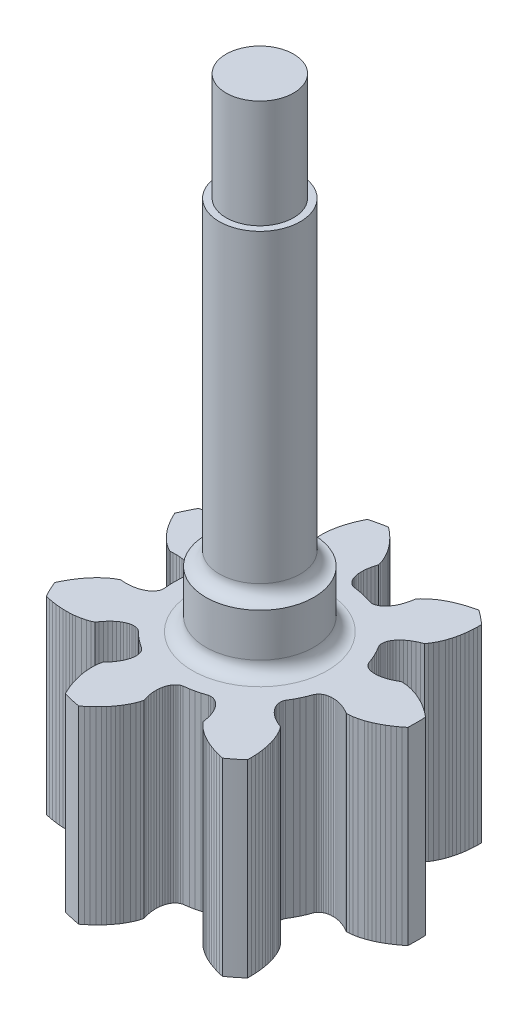
from build123d import *

# Parameters (mm, degrees)
SKETCH1_R           = 2
BOSS_EXTRUDE1_DEPTH = 2.1
SKETCH2_R           = 1.5
BOSS_EXTRUDE3_DEPTH = 15.8
BOSS_EXTRUDE4_DEPTH = 7
SKETCH3_R           = 1.1
SKETCH3_R_2         = 0.75
CUT_EXTRUDE2_DEPTH  = 20.676208923
FILLET1_R           = 0.5
CHAMFER1_SIZE       = 0.4
CUT_EXTRUDE3_START  = -4
SKETCH5_R           = 1.5
SKETCH5_R_2         = 1.25
CUT_EXTRUDE3_DEPTH  = 4


with BuildPart() as part:
    # Sketch1 → Boss-Extrude1 (new body)
    with BuildSketch(Plane(origin=(0, 0, 0), x_dir=(1, 0, 0), z_dir=(0, 1, 0))):
        with Locations(Location((0, 0, 0), (0, 0, 270))):
            Circle(SKETCH1_R)
    extrude(amount=BOSS_EXTRUDE1_DEPTH)

    # Sketch2 → Boss-Extrude3 (add)
    with BuildSketch(Plane(origin=(0, 2.1, 0), x_dir=(1, 0, 0), z_dir=(0, 1, 0))):
        with Locations(Location((0, 0, 0), (0, 0, 270))):
            Circle(SKETCH2_R)
    extrude(amount=BOSS_EXTRUDE3_DEPTH)

    # Sketch4 → Boss-Extrude4 (add)
    with BuildSketch(Plane.XZ):
        with BuildLine():
            Line((-1.677656104, -5.457545802), (-1.740166904, -5.314388502))
            Line((-1.740166904, -5.314388502), (-1.793915704, -5.175673402))
            Line((-1.793915704, -5.175673402), (-1.839244704, -5.042342702))
            Line((-1.839244704, -5.042342702), (-1.876421604, -4.915999102))
            Line((-1.876421604, -4.915999102), (-1.907053904, -4.793237402))
            Line((-1.907053904, -4.793237402), (-1.931099704, -4.676009702))
            Line((-1.931099704, -4.676009702), (-1.948773704, -4.566830802))
            Line((-1.948773704, -4.566830802), (-1.961024804, -4.464035702))
            Line((-1.961024804, -4.464035702), (-1.971502404, -4.279785302))
            Line((-1.971502404, -4.279785302), (-1.967365804, -4.124635702))
            Line((-1.967365804, -4.124635702), (-1.953730504, -4.000928102))
            Line((-1.953730504, -4.000928102), (-1.930260404, -3.886700602))
            Line((-1.930260404, -3.886700602), (-1.859391804, -3.809735002))
            Line((-1.859391804, -3.809735002), (-1.778417204, -3.712510502))
            Line((-1.778417204, -3.712510502), (-1.708697804, -3.615493902))
            Line((-1.708697804, -3.615493902), (-1.650076104, -3.519450202))
            Line((-1.650076104, -3.519450202), (-1.602332404, -3.425130202))
            Line((-1.602332404, -3.425130202), (-1.565200104, -3.333258302))
            Line((-1.565200104, -3.333258302), (-1.538382904, -3.244569502))
            Line((-1.538382904, -3.244569502), (-1.521548504, -3.159737902))
            Line((-1.521548504, -3.159737902), (-1.514299404, -3.079451802))
            Line((-1.514299404, -3.079451802), (-1.516222204, -3.004347502))
            Line((-1.516222204, -3.004347502), (-1.526863004, -2.935043002))
            Line((-1.526863004, -2.935043002), (-1.545721204, -2.872129302))
            Line((-1.545721204, -2.872129302), (-1.572279104, -2.816160102))
            Line((-1.572279104, -2.816160102), (-1.605971904, -2.767662302))
            Line((-1.605971904, -2.767662302), (-1.657232504, -2.718290402))
            Line((-1.657232504, -2.718290402), (-1.844744204, -2.592775302))
            Line((-1.844744204, -2.592775302), (-1.984007204, -2.487817902))
            Line((-1.984007204, -2.487817902), (-2.117322004, -2.375401802))
            Line((-2.117322004, -2.375401802), (-2.281415504, -2.220521102))
            Line((-2.281415504, -2.220521102), (-2.340956004, -2.181532002))
            Line((-2.340956004, -2.181532002), (-2.395735304, -2.159475702))
            Line((-2.395735304, -2.159475702), (-2.456210904, -2.146038102))
            Line((-2.456210904, -2.146038102), (-2.521743604, -2.141652302))
            Line((-2.521743604, -2.141652302), (-2.591678304, -2.146699902))
            Line((-2.591678304, -2.146699902), (-2.665327304, -2.161537602))
            Line((-2.665327304, -2.161537602), (-2.741987504, -2.186470302))
            Line((-2.741987504, -2.186470302), (-2.820946104, -2.221759402))
            Line((-2.820946104, -2.221759402), (-2.901443904, -2.267639402))
            Line((-2.901443904, -2.267639402), (-2.982749704, -2.324284202))
            Line((-2.982749704, -2.324284202), (-3.064080904, -2.391819002))
            Line((-3.064080904, -2.391819002), (-3.144672004, -2.470342602))
            Line((-3.144672004, -2.470342602), (-3.223742204, -2.559902302))
            Line((-3.223742204, -2.559902302), (-3.300510504, -2.660481102))
            Line((-3.300510504, -2.660481102), (-3.359776704, -2.746699402))
            Line((-3.359776704, -2.746699402), (-3.465917704, -2.794999002))
            Line((-3.465917704, -2.794999002), (-3.583489604, -2.835820002))
            Line((-3.583489604, -2.835820002), (-3.733828804, -2.874377002))
            Line((-3.733828804, -2.874377002), (-3.915791104, -2.905161502))
            Line((-3.915791104, -2.905161502), (-4.018735004, -2.916091602))
            Line((-4.018735004, -2.916091602), (-4.129109504, -2.923155402))
            Line((-4.129109504, -2.923155402), (-4.248748704, -2.925798102))
            Line((-4.248748704, -2.925798102), (-4.375248804, -2.923250802))
            Line((-4.375248804, -2.923250802), (-4.506697404, -2.915120202))
            Line((-4.506697404, -2.915120202), (-4.646771904, -2.900596502))
            Line((-4.646771904, -2.900596502), (-4.793969404, -2.879062302))
            Line((-4.793969404, -2.879062302), (-4.947447304, -2.849974302))
            Line((-4.947447304, -2.849974302), (-5.090225304, -2.816749202))
            ThreePointArc((-5.090225304, -2.816749202), (-5.241476502, -2.524161997), (-5.375926806, -2.223483907))
            Line((-5.375926806, -2.223483907), (-5.312882596, -2.091140098))
            Line((-5.312882596, -2.091140098), (-5.239932596, -1.953010098))
            Line((-5.239932596, -1.953010098), (-5.164992596, -1.824500098))
            Line((-5.164992596, -1.824500098), (-5.089012596, -1.705930098))
            Line((-5.089012596, -1.705930098), (-5.013412596, -1.598090098))
            Line((-5.013412596, -1.598090098), (-4.936532596, -1.497600098))
            Line((-4.936532596, -1.497600098), (-4.859872596, -1.405710098))
            Line((-4.859872596, -1.405710098), (-4.785532596, -1.323820098))
            Line((-4.785532596, -1.323820098), (-4.712802596, -1.250150098))
            Line((-4.712802596, -1.250150098), (-4.575282596, -1.127080098))
            Line((-4.575282596, -1.127080098), (-4.451402596, -1.033580098))
            Line((-4.451402596, -1.033580098), (-4.346182596, -0.967110098))
            Line((-4.346182596, -0.967110098), (-4.242242596, -0.914240098))
            Line((-4.242242596, -0.914240098), (-4.137882596, -0.921660098))
            Line((-4.137882596, -0.921660098), (-4.011382596, -0.924350098))
            Line((-4.011382596, -0.924350098), (-3.892062596, -0.918370098))
            Line((-3.892062596, -0.918370098), (-3.780422596, -0.904320098))
            Line((-3.780422596, -0.904320098), (-3.676912596, -0.882840098))
            Line((-3.676912596, -0.882840098), (-3.581932596, -0.854590098))
            Line((-3.581932596, -0.854590098), (-3.495872596, -0.820260098))
            Line((-3.495872596, -0.820260098), (-3.419052596, -0.780530098))
            Line((-3.419052596, -0.780530098), (-3.351762596, -0.736140098))
            Line((-3.351762596, -0.736140098), (-3.294242596, -0.687810098))
            Line((-3.294242596, -0.687810098), (-3.246692596, -0.636280098))
            Line((-3.246692596, -0.636280098), (-3.209262596, -0.582310098))
            Line((-3.209262596, -0.582310098), (-3.182062596, -0.526650098))
            Line((-3.182062596, -0.526650098), (-3.165152596, -0.470070098))
            Line((-3.165152596, -0.470070098), (-3.158512596, -0.399210098))
            Line((-3.158512596, -0.399210098), (-3.177292596, -0.174350098))
            Line((-3.177292596, -0.174350098), (-3.182062596, -3.0098e-05))
            Line((-3.182062596, -3.0098e-05), (-3.177292596, 0.174289902))
            Line((-3.177292596, 0.174289902), (-3.158512596, 0.399149902))
            Line((-3.158512596, 0.399149902), (-3.165152596, 0.470009902))
            Line((-3.165152596, 0.470009902), (-3.182062596, 0.526589902))
            Line((-3.182062596, 0.526589902), (-3.209262596, 0.582249902))
            Line((-3.209262596, 0.582249902), (-3.246692596, 0.636219902))
            Line((-3.246692596, 0.636219902), (-3.294242596, 0.687749902))
            Line((-3.294242596, 0.687749902), (-3.351762596, 0.736079902))
            Line((-3.351762596, 0.736079902), (-3.419052596, 0.780469902))
            Line((-3.419052596, 0.780469902), (-3.495872596, 0.820199902))
            Line((-3.495872596, 0.820199902), (-3.581932596, 0.854529902))
            Line((-3.581932596, 0.854529902), (-3.676912596, 0.882779902))
            Line((-3.676912596, 0.882779902), (-3.780422596, 0.904259902))
            Line((-3.780422596, 0.904259902), (-3.892062596, 0.918309902))
            Line((-3.892062596, 0.918309902), (-4.011382596, 0.924289902))
            Line((-4.011382596, 0.924289902), (-4.137882596, 0.921599902))
            Line((-4.137882596, 0.921599902), (-4.242242596, 0.914179902))
            Line((-4.242242596, 0.914179902), (-4.346182596, 0.967049902))
            Line((-4.346182596, 0.967049902), (-4.451402596, 1.033519902))
            Line((-4.451402596, 1.033519902), (-4.575282596, 1.127019902))
            Line((-4.575282596, 1.127019902), (-4.712802596, 1.250089902))
            Line((-4.712802596, 1.250089902), (-4.785532596, 1.323759902))
            Line((-4.785532596, 1.323759902), (-4.859872596, 1.405649902))
            Line((-4.859872596, 1.405649902), (-4.936532596, 1.497539902))
            Line((-4.936532596, 1.497539902), (-5.013412596, 1.598029902))
            Line((-5.013412596, 1.598029902), (-5.089012596, 1.705869902))
            Line((-5.089012596, 1.705869902), (-5.164992596, 1.824439902))
            Line((-5.164992596, 1.824439902), (-5.239932596, 1.952949902))
            Line((-5.239932596, 1.952949902), (-5.312882596, 2.091079902))
            Line((-5.312882596, 2.091079902), (-5.375926796, 2.223423702))
            ThreePointArc((-5.375926796, 2.223423702), (-5.241476491, 2.524101771), (-5.090225294, 2.816688957))
            Line((-5.090225294, 2.816688957), (-4.947447286, 2.849914054))
            Line((-4.947447286, 2.849914054), (-4.793969386, 2.879002054))
            Line((-4.793969386, 2.879002054), (-4.646771886, 2.900536254))
            Line((-4.646771886, 2.900536254), (-4.506697386, 2.915059954))
            Line((-4.506697386, 2.915059954), (-4.375248786, 2.923190554))
            Line((-4.375248786, 2.923190554), (-4.248748686, 2.925737854))
            Line((-4.248748686, 2.925737854), (-4.129109486, 2.923095154))
            Line((-4.129109486, 2.923095154), (-4.018734986, 2.916031354))
            Line((-4.018734986, 2.916031354), (-3.915791086, 2.905101254))
            Line((-3.915791086, 2.905101254), (-3.733828786, 2.874316754))
            Line((-3.733828786, 2.874316754), (-3.583489586, 2.835759754))
            Line((-3.583489586, 2.835759754), (-3.465917686, 2.794938754))
            Line((-3.465917686, 2.794938754), (-3.359776686, 2.746639154))
            Line((-3.359776686, 2.746639154), (-3.300510486, 2.660420854))
            Line((-3.300510486, 2.660420854), (-3.223742186, 2.559842054))
            Line((-3.223742186, 2.559842054), (-3.144671986, 2.470282354))
            Line((-3.144671986, 2.470282354), (-3.064080886, 2.391758754))
            Line((-3.064080886, 2.391758754), (-2.982749686, 2.324223954))
            Line((-2.982749686, 2.324223954), (-2.901443886, 2.267579154))
            Line((-2.901443886, 2.267579154), (-2.820946086, 2.221699154))
            Line((-2.820946086, 2.221699154), (-2.741987486, 2.186410054))
            Line((-2.741987486, 2.186410054), (-2.665327286, 2.161477354))
            Line((-2.665327286, 2.161477354), (-2.591678286, 2.146639654))
            Line((-2.591678286, 2.146639654), (-2.521743586, 2.141592054))
            Line((-2.521743586, 2.141592054), (-2.456210886, 2.145977854))
            Line((-2.456210886, 2.145977854), (-2.395735286, 2.159415454))
            Line((-2.395735286, 2.159415454), (-2.340955986, 2.181471754))
            Line((-2.340955986, 2.181471754), (-2.281415486, 2.220460854))
            Line((-2.281415486, 2.220460854), (-2.117321986, 2.375341554))
            Line((-2.117321986, 2.375341554), (-1.984007186, 2.487757654))
            Line((-1.984007186, 2.487757654), (-1.844744186, 2.592715054))
            Line((-1.844744186, 2.592715054), (-1.657232486, 2.718230154))
            Line((-1.657232486, 2.718230154), (-1.605971886, 2.767602054))
            Line((-1.605971886, 2.767602054), (-1.572279086, 2.816099854))
            Line((-1.572279086, 2.816099854), (-1.545721186, 2.872069054))
            Line((-1.545721186, 2.872069054), (-1.526862986, 2.934982754))
            Line((-1.526862986, 2.934982754), (-1.516222186, 3.004287254))
            Line((-1.516222186, 3.004287254), (-1.514299386, 3.079391554))
            Line((-1.514299386, 3.079391554), (-1.521548486, 3.159677654))
            Line((-1.521548486, 3.159677654), (-1.538382886, 3.244509254))
            Line((-1.538382886, 3.244509254), (-1.565200086, 3.333198054))
            Line((-1.565200086, 3.333198054), (-1.602332386, 3.425069954))
            Line((-1.602332386, 3.425069954), (-1.650076086, 3.519389954))
            Line((-1.650076086, 3.519389954), (-1.708697786, 3.615433654))
            Line((-1.708697786, 3.615433654), (-1.778417186, 3.712450254))
            Line((-1.778417186, 3.712450254), (-1.859391786, 3.809674754))
            Line((-1.859391786, 3.809674754), (-1.930260386, 3.886640354))
            Line((-1.930260386, 3.886640354), (-1.953730486, 4.000867854))
            Line((-1.953730486, 4.000867854), (-1.967365786, 4.124575454))
            Line((-1.967365786, 4.124575454), (-1.971502386, 4.279725054))
            Line((-1.971502386, 4.279725054), (-1.961024786, 4.463975454))
            Line((-1.961024786, 4.463975454), (-1.948773686, 4.566770554))
            Line((-1.948773686, 4.566770554), (-1.931099686, 4.675949454))
            Line((-1.931099686, 4.675949454), (-1.907053886, 4.793177154))
            Line((-1.907053886, 4.793177154), (-1.876421586, 4.915938854))
            Line((-1.876421586, 4.915938854), (-1.839244686, 5.042282454))
            Line((-1.839244686, 5.042282454), (-1.793915686, 5.175613154))
            Line((-1.793915686, 5.175613154), (-1.740166886, 5.314328254))
            Line((-1.740166886, 5.314328254), (-1.677656086, 5.457485554))
            Line((-1.677656086, 5.457485554), (-1.613492886, 5.589290554))
            ThreePointArc((-1.613492886, 5.589290554), (-1.294584924, 5.671642777), (-0.971527485, 5.735814951))
            Line((-0.971527485, 5.735814951), (-0.856530379, 5.644902123))
            Line((-0.856530379, 5.644902123), (-0.738096579, 5.543044323))
            Line((-0.738096579, 5.543044323), (-0.629484279, 5.441387023))
            Line((-0.629484279, 5.441387023), (-0.530794179, 5.340927723))
            Line((-0.530794179, 5.340927723), (-0.442480579, 5.243226523))
            Line((-0.442480579, 5.243226523), (-0.361617479, 5.145912923))
            Line((-0.361617479, 5.145912923), (-0.289089779, 5.050727423))
            Line((-0.289089779, 5.050727423), (-0.225795179, 4.960029123))
            Line((-0.225795179, 4.960029123), (-0.170156179, 4.872729423))
            Line((-0.170156179, 4.872729423), (-0.080772879, 4.711271723))
            Line((-0.080772879, 4.711271723), (-0.017182979, 4.569691923))
            Line((-0.017182979, 4.569691923), (0.024206821, 4.452319023))
            Line((0.024206821, 4.452319023), (0.052622421, 4.339220423))
            Line((0.052622421, 4.339220423), (0.022166221, 4.239128023))
            Line((0.022166221, 4.239128023), (-0.008605279, 4.116398223))
            Line((-0.008605279, 4.116398223), (-0.029326379, 3.998739123))
            Line((-0.029326379, 3.998739123), (-0.040470879, 3.886771723))
            Line((-0.040470879, 3.886771723), (-0.042562579, 3.781077223))
            Line((-0.042562579, 3.781077223), (-0.036155879, 3.682192323))
            Line((-0.036155879, 3.682192323), (-0.021836779, 3.590650923))
            Line((-0.021836779, 3.590650923), (-0.000196979, 3.506916223))
            Line((-0.000196979, 3.506916223), (0.028106621, 3.431435623))
            Line((0.028106621, 3.431435623), (0.062425521, 3.364603323))
            Line((0.062425521, 3.364603323), (0.102082621, 3.306779023))
            Line((0.102082621, 3.306779023), (0.146370621, 3.258277923))
            Line((0.146370621, 3.258277923), (0.194582521, 3.219374423))
            Line((0.194582521, 3.219374423), (0.245981121, 3.190298123))
            Line((0.245981121, 3.190298123), (0.313586921, 3.168056823))
            Line((0.313586921, 3.168056823), (0.536988121, 3.136329923))
            Line((0.536988121, 3.136329923), (0.707999021, 3.102190423))
            Line((0.707999021, 3.102190423), (0.876887021, 3.058750223))
            Line((0.876887021, 3.058750223), (1.091930421, 2.990405023))
            Line((1.091930421, 2.990405023), (1.162491321, 2.981110623))
            Line((1.162491321, 2.981110623), (1.221415521, 2.985006423))
            Line((1.221415521, 2.985006423), (1.281732621, 2.999139023))
            Line((1.281732621, 2.999139023), (1.342678421, 3.023621123))
            Line((1.342678421, 3.023621123), (1.403497321, 3.058512423))
            Line((1.403497321, 3.058512423), (1.463415021, 3.103835823))
            Line((1.463415021, 3.103835823), (1.521665521, 3.159561023))
            Line((1.521665521, 3.159561023), (1.577493421, 3.225614223))
            Line((1.577493421, 3.225614223), (1.630112821, 3.301877423))
            Line((1.630112821, 3.301877423), (1.678789621, 3.388189823))
            Line((1.678789621, 3.388189823), (1.722764221, 3.484324823))
            Line((1.722764221, 3.484324823), (1.761304221, 3.590039423))
            Line((1.761304221, 3.590039423), (1.793685421, 3.705037123))
            Line((1.793685421, 3.705037123), (1.819211821, 3.828964023))
            Line((1.819211821, 3.828964023), (1.835200121, 3.932358623))
            Line((1.835200121, 3.932358623), (1.909873421, 4.021928023))
            Line((1.909873421, 4.021928023), (1.998090521, 4.109718923))
            Line((1.998090521, 4.109718923), (2.116812121, 4.209687323))
            Line((2.116812121, 4.209687323), (2.267397621, 4.316373723))
            Line((2.267397621, 4.316373723), (2.355404521, 4.370887123))
            Line((2.355404521, 4.370887123), (2.451783521, 4.425141023))
            Line((2.451783521, 4.425141023), (2.558428121, 4.479431523))
            Line((2.558428121, 4.479431523), (2.673506021, 4.532022823))
            Line((2.673506021, 4.532022823), (2.795464821, 4.581730723))
            Line((2.795464821, 4.581730723), (2.927969221, 4.629421523))
            Line((2.927969221, 4.629421523), (3.069932921, 4.673886423))
            Line((3.069932921, 4.673886423), (3.220832621, 4.714270623))
            Line((3.220832621, 4.714270623), (3.363886921, 4.746284823))
            ThreePointArc((3.363886921, 4.746284823), (3.627108363, 4.548298309), (3.878703226, 4.335732528))
            Line((3.878703226, 4.335732528), (3.879324236, 4.189141042))
            Line((3.879324236, 4.189141042), (3.873530936, 4.033038442))
            Line((3.873530936, 4.033038442), (3.861770736, 3.884739642))
            Line((3.861770736, 3.884739642), (3.844760636, 3.744945242))
            Line((3.844760636, 3.744945242), (3.823437436, 3.614983242))
            Line((3.823437436, 3.614983242), (3.797771936, 3.491087842))
            Line((3.797771936, 3.491087842), (3.768573236, 3.375036342))
            Line((3.768573236, 3.375036342), (3.737125936, 3.269001042))
            Line((3.737125936, 3.269001042), (3.703562736, 3.171070342))
            Line((3.703562736, 3.171070342), (3.633059536, 3.000520342))
            Line((3.633059536, 3.000520342), (3.562015636, 2.862530242))
            Line((3.562015636, 2.862530242), (3.496055936, 2.756989642))
            Line((3.496055936, 2.756989642), (3.425348736, 2.664257542))
            Line((3.425348736, 2.664257542), (3.328104136, 2.625662642))
            Line((3.328104136, 2.625662642), (3.212964436, 2.573199942))
            Line((3.212964436, 2.573199942), (3.108055436, 2.516041142))
            Line((3.108055436, 2.516041142), (3.013567336, 2.454943742))
            Line((3.013567336, 2.454943742), (2.929627936, 2.390679642))
            Line((2.929627936, 2.390679642), (2.856311136, 2.324016942))
            Line((2.856311136, 2.324016942), (2.793668936, 2.255746642))
            Line((2.793668936, 2.255746642), (2.741694736, 2.186620242))
            Line((2.741694736, 2.186620242), (2.700328636, 2.117430142))
            Line((2.700328636, 2.117430142), (2.669474536, 2.048929342))
            Line((2.669474536, 2.048929342), (2.648991436, 1.981871242))
            Line((2.648991436, 1.981871242), (2.638684936, 1.917005642))
            Line((2.638684936, 1.917005642), (2.638328536, 1.855056142))
            Line((2.638328536, 1.855056142), (2.647642236, 1.796742342))
            Line((2.647642236, 1.796742342), (2.672404836, 1.730018642))
            Line((2.672404836, 1.730018642), (2.786888136, 1.535575142))
            Line((2.786888136, 1.535575142), (2.866820336, 1.380587942))
            Line((2.866820336, 1.380587942), (2.938157336, 1.221461342))
            Line((2.938157336, 1.221461342), (3.018800236, 1.010721142))
            Line((3.018800236, 1.010721142), (3.055527736, 0.949759542))
            Line((3.055527736, 0.949759542), (3.095312236, 0.906119642))
            Line((3.095312236, 0.906119642), (3.143968536, 0.867773342))
            Line((3.143968536, 0.867773342), (3.201108536, 0.835388342))
            Line((3.201108536, 0.835388342), (3.266307636, 0.809592642))
            Line((3.266307636, 0.809592642), (3.339100936, 0.791005742))
            Line((3.339100936, 0.791005742), (3.418987236, 0.780207842))
            Line((3.418987236, 0.780207842), (3.505437836, 0.777743242))
            Line((3.505437836, 0.777743242), (3.597870436, 0.784153042))
            Line((3.597870436, 0.784153042), (3.695701736, 0.799910942))
            Line((3.695701736, 0.799910942), (3.798280836, 0.825469442))
            Line((3.798280836, 0.825469442), (3.904961036, 0.861249642))
            Line((3.904961036, 0.861249642), (4.015059336, 0.907632842))
            Line((4.015059336, 0.907632842), (4.127864736, 0.964942742))
            Line((4.127864736, 0.964942742), (4.218670436, 1.016908042))
            Line((4.218670436, 1.016908042), (4.335256536, 1.014371642))
            Line((4.335256536, 1.014371642), (4.458896736, 1.000137542))
            Line((4.458896736, 1.000137542), (4.611076836, 0.969646442))
            Line((4.611076836, 0.969646442), (4.788376236, 0.918431942))
            Line((4.788376236, 0.918431942), (4.885867836, 0.883613842))
            Line((4.885867836, 0.883613842), (4.988376636, 0.842088442))
            Line((4.988376636, 0.842088442), (5.097314536, 0.792559942))
            Line((5.097314536, 0.792559942), (5.210181936, 0.735378542))
            Line((5.210181936, 0.735378542), (5.325085236, 0.671019742))
            Line((5.325085236, 0.671019742), (5.444986436, 0.597158342))
            Line((5.444986436, 0.597158342), (5.568263436, 0.513890042))
            Line((5.568263436, 0.513890042), (5.693921436, 0.421091042))
            Line((5.693921436, 0.421091042), (5.808144136, 0.329207242))
            ThreePointArc((5.808144136, 0.329207242), (5.817467929, -3.016e-05), (5.808144136, -0.329267562))
            Line((5.808144136, -0.329267562), (5.693921429, -0.421151358))
            Line((5.693921429, -0.421151358), (5.568263429, -0.513950358))
            Line((5.568263429, -0.513950358), (5.444986429, -0.597218658))
            Line((5.444986429, -0.597218658), (5.325085229, -0.671080058))
            Line((5.325085229, -0.671080058), (5.210181929, -0.735438858))
            Line((5.210181929, -0.735438858), (5.097314529, -0.792620258))
            Line((5.097314529, -0.792620258), (4.988376629, -0.842148758))
            Line((4.988376629, -0.842148758), (4.885867829, -0.883674158))
            Line((4.885867829, -0.883674158), (4.788376229, -0.918492258))
            Line((4.788376229, -0.918492258), (4.611076829, -0.969706758))
            Line((4.611076829, -0.969706758), (4.458896729, -1.000197858))
            Line((4.458896729, -1.000197858), (4.335256529, -1.014431958))
            Line((4.335256529, -1.014431958), (4.218670429, -1.016968358))
            Line((4.218670429, -1.016968358), (4.127864729, -0.965003058))
            Line((4.127864729, -0.965003058), (4.015059329, -0.907693158))
            Line((4.015059329, -0.907693158), (3.904961029, -0.861309958))
            Line((3.904961029, -0.861309958), (3.798280829, -0.825529758))
            Line((3.798280829, -0.825529758), (3.695701729, -0.799971258))
            Line((3.695701729, -0.799971258), (3.597870429, -0.784213358))
            Line((3.597870429, -0.784213358), (3.505437829, -0.777803558))
            Line((3.505437829, -0.777803558), (3.418987229, -0.780268158))
            Line((3.418987229, -0.780268158), (3.339100929, -0.791066058))
            Line((3.339100929, -0.791066058), (3.266307629, -0.809652958))
            Line((3.266307629, -0.809652958), (3.201108529, -0.835448658))
            Line((3.201108529, -0.835448658), (3.143968529, -0.867833658))
            Line((3.143968529, -0.867833658), (3.095312229, -0.906179958))
            Line((3.095312229, -0.906179958), (3.055527729, -0.949819858))
            Line((3.055527729, -0.949819858), (3.018800229, -1.010781458))
            Line((3.018800229, -1.010781458), (2.938157329, -1.221521658))
            Line((2.938157329, -1.221521658), (2.866820329, -1.380648258))
            Line((2.866820329, -1.380648258), (2.786888129, -1.535635458))
            Line((2.786888129, -1.535635458), (2.672404829, -1.730078958))
            Line((2.672404829, -1.730078958), (2.647642229, -1.796802658))
            Line((2.647642229, -1.796802658), (2.638328529, -1.855116458))
            Line((2.638328529, -1.855116458), (2.638684929, -1.917065958))
            Line((2.638684929, -1.917065958), (2.648991429, -1.981931558))
            Line((2.648991429, -1.981931558), (2.669474529, -2.048989658))
            Line((2.669474529, -2.048989658), (2.700328629, -2.117490458))
            Line((2.700328629, -2.117490458), (2.741694729, -2.186680558))
            Line((2.741694729, -2.186680558), (2.793668929, -2.255806958))
            Line((2.793668929, -2.255806958), (2.856311129, -2.324077258))
            Line((2.856311129, -2.324077258), (2.929627929, -2.390739958))
            Line((2.929627929, -2.390739958), (3.013567329, -2.455004058))
            Line((3.013567329, -2.455004058), (3.108055429, -2.516101458))
            Line((3.108055429, -2.516101458), (3.212964429, -2.573260258))
            Line((3.212964429, -2.573260258), (3.328104129, -2.625722958))
            Line((3.328104129, -2.625722958), (3.425348729, -2.664317858))
            Line((3.425348729, -2.664317858), (3.496055929, -2.757049958))
            Line((3.496055929, -2.757049958), (3.562015629, -2.862590558))
            Line((3.562015629, -2.862590558), (3.633059529, -3.000580658))
            Line((3.633059529, -3.000580658), (3.703562729, -3.171130658))
            Line((3.703562729, -3.171130658), (3.737125929, -3.269061358))
            Line((3.737125929, -3.269061358), (3.768573229, -3.375096658))
            Line((3.768573229, -3.375096658), (3.797771929, -3.491148158))
            Line((3.797771929, -3.491148158), (3.823437429, -3.615043558))
            Line((3.823437429, -3.615043558), (3.844760629, -3.745005558))
            Line((3.844760629, -3.745005558), (3.861770729, -3.884799958))
            Line((3.861770729, -3.884799958), (3.873530929, -4.033098758))
            Line((3.873530929, -4.033098758), (3.879324229, -4.189201358))
            Line((3.879324229, -4.189201358), (3.878703229, -4.335792858))
            ThreePointArc((3.878703229, -4.335792858), (3.627108367, -4.548358644), (3.363886927, -4.746345161))
            Line((3.363886927, -4.746345161), (3.220832594, -4.714330914))
            Line((3.220832594, -4.714330914), (3.069932894, -4.673946714))
            Line((3.069932894, -4.673946714), (2.927969194, -4.629481814))
            Line((2.927969194, -4.629481814), (2.795464794, -4.581791014))
            Line((2.795464794, -4.581791014), (2.673505994, -4.532083114))
            Line((2.673505994, -4.532083114), (2.558428094, -4.479491814))
            Line((2.558428094, -4.479491814), (2.451783494, -4.425201314))
            Line((2.451783494, -4.425201314), (2.355404494, -4.370947414))
            Line((2.355404494, -4.370947414), (2.267397594, -4.316434014))
            Line((2.267397594, -4.316434014), (2.116812094, -4.209747614))
            Line((2.116812094, -4.209747614), (1.998090494, -4.109779214))
            Line((1.998090494, -4.109779214), (1.909873394, -4.021988314))
            Line((1.909873394, -4.021988314), (1.835200094, -3.932418914))
            Line((1.835200094, -3.932418914), (1.819211794, -3.829024314))
            Line((1.819211794, -3.829024314), (1.793685394, -3.705097414))
            Line((1.793685394, -3.705097414), (1.761304194, -3.590099714))
            Line((1.761304194, -3.590099714), (1.722764194, -3.484385114))
            Line((1.722764194, -3.484385114), (1.678789594, -3.388250114))
            Line((1.678789594, -3.388250114), (1.630112794, -3.301937714))
            Line((1.630112794, -3.301937714), (1.577493394, -3.225674514))
            Line((1.577493394, -3.225674514), (1.521665494, -3.159621314))
            Line((1.521665494, -3.159621314), (1.463414994, -3.103896114))
            Line((1.463414994, -3.103896114), (1.403497294, -3.058572714))
            Line((1.403497294, -3.058572714), (1.342678394, -3.023681414))
            Line((1.342678394, -3.023681414), (1.281732594, -2.999199314))
            Line((1.281732594, -2.999199314), (1.221415494, -2.985066714))
            Line((1.221415494, -2.985066714), (1.162491294, -2.981170914))
            Line((1.162491294, -2.981170914), (1.091930394, -2.990465314))
            Line((1.091930394, -2.990465314), (0.876886994, -3.058810514))
            Line((0.876886994, -3.058810514), (0.707998994, -3.102250714))
            Line((0.707998994, -3.102250714), (0.536988094, -3.136390214))
            Line((0.536988094, -3.136390214), (0.313586894, -3.168117114))
            Line((0.313586894, -3.168117114), (0.245981094, -3.190358414))
            Line((0.245981094, -3.190358414), (0.194582494, -3.219434714))
            Line((0.194582494, -3.219434714), (0.146370594, -3.258338214))
            Line((0.146370594, -3.258338214), (0.102082594, -3.306839314))
            Line((0.102082594, -3.306839314), (0.062425494, -3.364663614))
            Line((0.062425494, -3.364663614), (0.028106594, -3.431495914))
            Line((0.028106594, -3.431495914), (-0.000197006, -3.506976514))
            Line((-0.000197006, -3.506976514), (-0.021836806, -3.590711214))
            Line((-0.021836806, -3.590711214), (-0.036155906, -3.682252614))
            Line((-0.036155906, -3.682252614), (-0.042562606, -3.781137514))
            Line((-0.042562606, -3.781137514), (-0.040470906, -3.886832014))
            Line((-0.040470906, -3.886832014), (-0.029326406, -3.998799414))
            Line((-0.029326406, -3.998799414), (-0.008605306, -4.116458514))
            Line((-0.008605306, -4.116458514), (0.022166194, -4.239188314))
            Line((0.022166194, -4.239188314), (0.052622394, -4.339280714))
            Line((0.052622394, -4.339280714), (0.024206794, -4.452379314))
            Line((0.024206794, -4.452379314), (-0.017183006, -4.569752214))
            Line((-0.017183006, -4.569752214), (-0.080772906, -4.711332014))
            Line((-0.080772906, -4.711332014), (-0.170156206, -4.872789714))
            Line((-0.170156206, -4.872789714), (-0.225795206, -4.960089414))
            Line((-0.225795206, -4.960089414), (-0.289089806, -5.050787714))
            Line((-0.289089806, -5.050787714), (-0.361617506, -5.145973214))
            Line((-0.361617506, -5.145973214), (-0.442480606, -5.243286814))
            Line((-0.442480606, -5.243286814), (-0.530794206, -5.340988014))
            Line((-0.530794206, -5.340988014), (-0.629484306, -5.441447314))
            Line((-0.629484306, -5.441447314), (-0.738096606, -5.543104614))
            Line((-0.738096606, -5.543104614), (-0.856530406, -5.644962414))
            Line((-0.856530406, -5.644962414), (-0.971527506, -5.735875214))
            ThreePointArc((-0.971527506, -5.735875214), (-1.294584942, -5.671703035), (-1.613492901, -5.589350807))
            Line((-1.613492901, -5.589350807), (-1.677656104, -5.457545802))
        make_face()
    extrude(amount=BOSS_EXTRUDE4_DEPTH)

    # Sketch3 → Cut-Extrude2 (cut, through all)
    # profile 1 of 2: a face of its own
    with BuildSketch(Plane.XZ):
        with Locations(Location((0, 0, 0), (0, 0, 90))):
            Circle(SKETCH3_R)
        Circle(SKETCH3_R_2, mode=Mode.SUBTRACT)
    # profile 2 of 2: a face of its own
    with BuildSketch(Plane.XZ):
        Circle(SKETCH3_R_2)
    extrude(amount=CUT_EXTRUDE2_DEPTH, mode=Mode.SUBTRACT)

    # Fillet1
    fillet1_edges = [part.edges().sort_by_distance(p)[0] for p in [
        (0, 0, -2),
        (0, 2.1, -1.5),
    ]]
    fillet(fillet1_edges, radius=FILLET1_R - 0.0001)  # a hair under: the kernel refuses the full size

    # Chamfer1
    chamfer1_edges = [part.edges().sort_by_distance(p)[0] for p in [
        (0, 0, -1.1),
        (0, -7, -1.1),
    ]]
    chamfer(chamfer1_edges, length=CHAMFER1_SIZE)

    # Sketch5 → Cut-Extrude3 (cut)
    with BuildSketch(Plane(origin=(0, 17.9, 0), x_dir=(1, 0, 0), z_dir=(0, 1, 0)).offset(CUT_EXTRUDE3_START)):
        with Locations(Location((0, 0, 0), (0, 0, 270))):
            Circle(SKETCH5_R)
        with Locations(Location((0, 0, 0), (0, 0, 270))):
            Circle(SKETCH5_R_2, mode=Mode.SUBTRACT)
    extrude(amount=CUT_EXTRUDE3_DEPTH, mode=Mode.SUBTRACT)


solid = part.part
